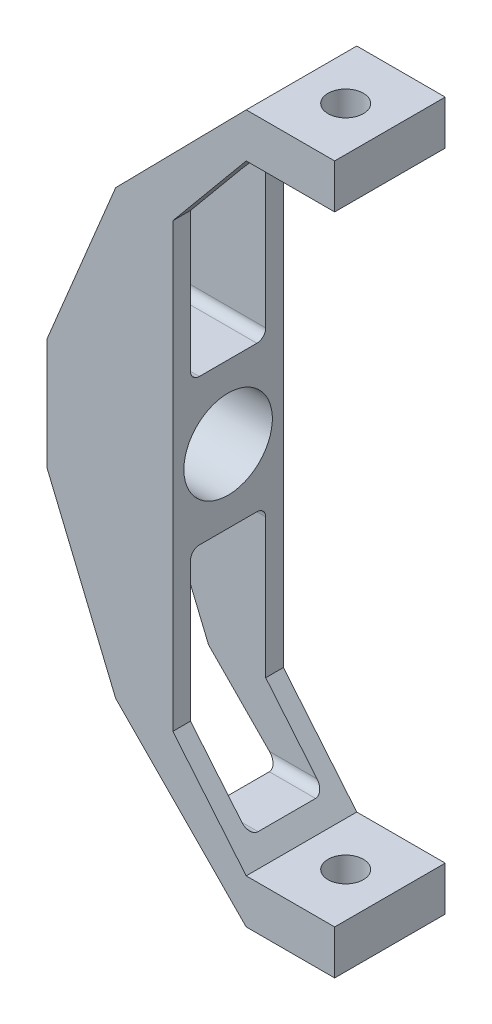
from build123d import *

# Parameters (mm, degrees)
BOSS_EXTRUDE1_DEPTH = 25
SKETCH3_R           = 10
CUT_EXTRUDE2_DEPTH  = 175.532828144
SKETCH4_R           = 4
CUT_EXTRUDE3_DEPTH  = 175.532828144


with BuildPart() as part:
    # Sketch1 → Boss-Extrude1 (new body)
    with BuildSketch(Plane.XY):
        Polygon((0, 0), (-20, 0), (-49.518324122, -30), (-65.09, -67.5), (-65.09, -92.5), (-49.518324122, -130), (-20, -160), (0, -160), (0, -150), (-20, -150), (-36.59, -130), (-36.59, -30), (-20, -10), (0, -10), align=None)
    extrude(amount=BOSS_EXTRUDE1_DEPTH)

    # Sketch3 → Cut-Extrude2 (cut, through all)
    with BuildSketch(Plane.ZY.offset(65.09)):
        with Locations((12.5, -80)):
            Circle(SKETCH3_R)
        with BuildLine():
            Line((6, -63.5), (19, -63.5))
            ThreePointArc((19, -63.5), (20.414213562, -62.914213562), (21, -61.5))
            Line((21, -61.5), (21, -15.999055713))
            ThreePointArc((21, -15.999055713), (20.414213562, -14.584842151), (19, -13.999055713))
            Line((19, -13.999055713), (6, -13.999055713))
            ThreePointArc((6, -13.999055713), (4.585786438, -14.584842151), (4, -15.999055713))
            Line((4, -15.999055713), (4, -61.5))
            ThreePointArc((4, -61.5), (4.585786438, -62.914213562), (6, -63.5))
        make_face()
        with BuildLine():
            Line((6, -146.000944287), (19, -146.000944287))
            ThreePointArc((19, -146.000944287), (20.414213562, -145.415157849), (21, -144.000944287))
            Line((21, -144.000944287), (21, -98.5))
            ThreePointArc((21, -98.5), (20.414213562, -97.085786438), (19, -96.5))
            Line((19, -96.5), (6, -96.5))
            ThreePointArc((6, -96.5), (4.585786438, -97.085786438), (4, -98.5))
            Line((4, -98.5), (4, -144.000944287))
            ThreePointArc((4, -144.000944287), (4.585786438, -145.415157849), (6, -146.000944287))
        make_face()
    extrude(amount=-CUT_EXTRUDE2_DEPTH, mode=Mode.SUBTRACT)

    # Sketch4 → Cut-Extrude3 (cut, through all)
    with BuildSketch(Plane(origin=(0, 0, 0), x_dir=(1, 0, 0), z_dir=(0, 1, 0))):
        with Locations((-10, -12.5)):
            Circle(SKETCH4_R)
    extrude(amount=-CUT_EXTRUDE3_DEPTH, mode=Mode.SUBTRACT)


solid = part.part
